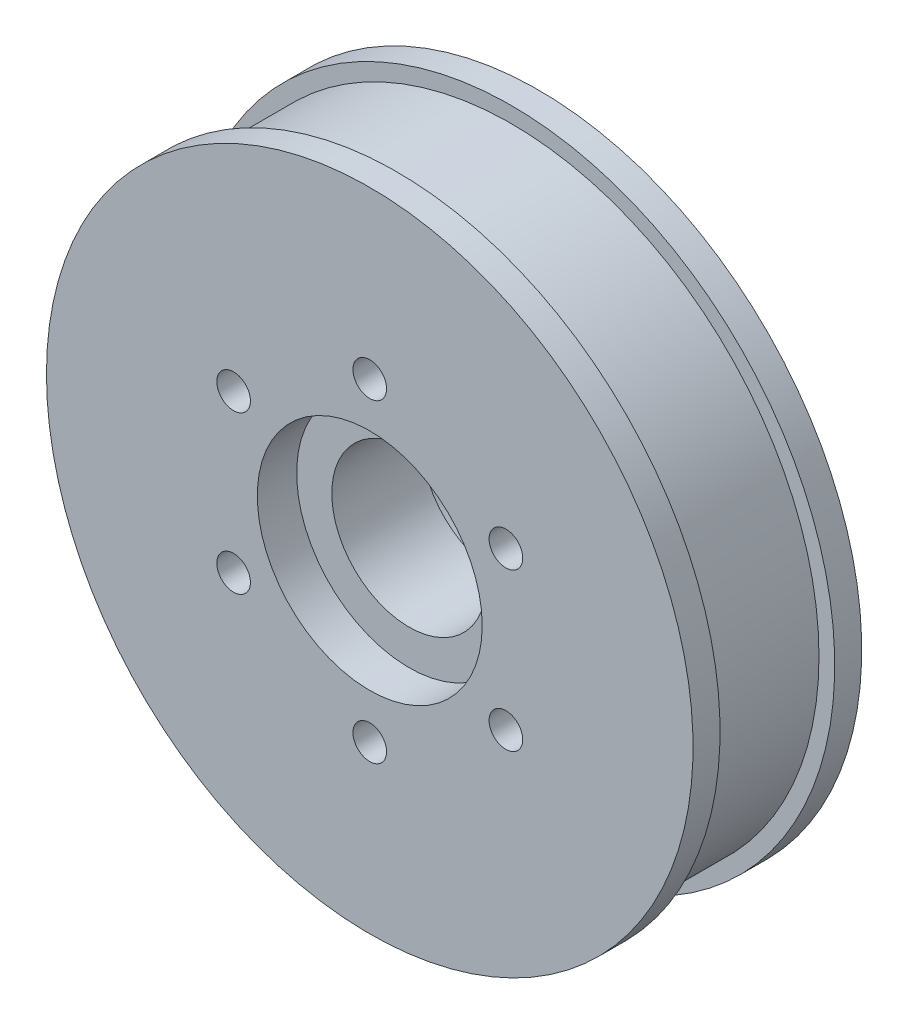
from build123d import *

# Parameters (mm, degrees)
SKETCH1_R             = 36.5125
BOSS_EXTRUDE1_DEPTH   = 19.05
SKETCH2_R             = 8.73125
CUT_EXTRUDE1_DEPTH    = 56.038421239
SKETCH3_R             = 12.7
CUT_EXTRUDE2_DEPTH    = 4.445
CUT_EXTRUDE3_START    = -4.445
SKETCH4_R             = 12.7
CUT_EXTRUDE3_DEPTH    = 4.445
F_6_CLEARANCE_HOLE1_D = 3.7973


with BuildPart() as part:
    # Sketch1 → Boss-Extrude1 (new body)
    with BuildSketch(Plane.XY):
        Circle(SKETCH1_R)
    extrude(amount=BOSS_EXTRUDE1_DEPTH)

    # Sketch2 → Cut-Extrude1 (cut, through all)
    with BuildSketch(Plane.XY.offset(19.05)):
        Circle(SKETCH2_R)
    extrude(amount=-CUT_EXTRUDE1_DEPTH, mode=Mode.SUBTRACT)

    # Sketch3 → Cut-Extrude2 (cut)
    with BuildSketch(Plane.XY.offset(19.05)):
        Circle(SKETCH3_R)
    extrude(amount=-CUT_EXTRUDE2_DEPTH, mode=Mode.SUBTRACT)

    # Sketch4 → Cut-Extrude3 (cut)
    with BuildSketch(Plane(origin=(0, 0, 0), x_dir=(-1, 0, 0), z_dir=(0, 0, -1)).offset(CUT_EXTRUDE3_START)):
        Circle(SKETCH4_R)
    extrude(amount=CUT_EXTRUDE3_DEPTH, mode=Mode.SUBTRACT)

    # #6 Clearance Hole1 (through all)
    with Locations(Plane(origin=(-8.170302988, -47.003517203, 19.05), x_dir=(1, 0, 0), z_dir=(0, 0, 1))):
        with Locations((8.170302988, 64.758117203), (-7.205631646, 55.880817203), (-7.205631646, 38.126217203), (8.170302988, 29.248917203), (23.546237622, 38.126217203), (23.546237622, 55.880817203)):
            Hole(F_6_CLEARANCE_HOLE1_D / 2)

    # Sketch10 → Cut-Revolve1 (revolve, cut)
    with BuildSketch(Plane(origin=(0, 0, 0), x_dir=(0, 0, -1), z_dir=(1, 0, 0))):
        Polygon((-16.002, 51.152208686), (-16.002, 36.5125), (-16.002, 34.7345), (-3.048, 34.7345), (-3.048, 36.5125), (-3.048, 51.152208686), align=None)
    revolve(axis=Axis((0, 0, 19.05), (0, 0, -1)), mode=Mode.SUBTRACT)


solid = part.part
